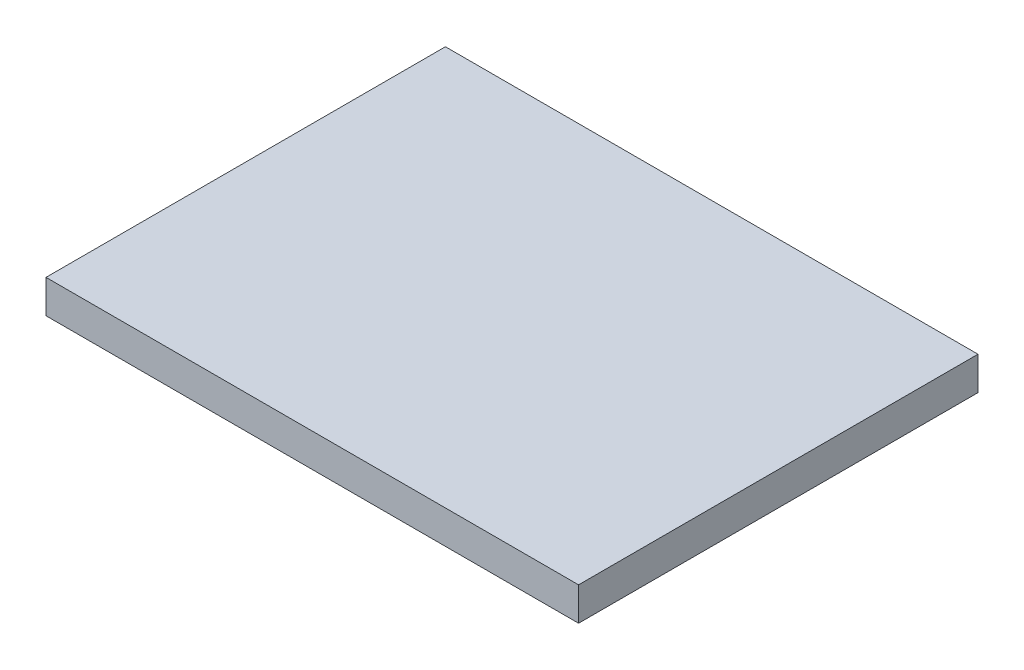
from build123d import *

# Parameters (mm, degrees)
SKETCH1_W           = 80
SKETCH1_H           = 60
BOSS_EXTRUDE1_DEPTH = 5


with BuildPart() as part:
    # Sketch1 → Boss-Extrude1 (new body)
    with BuildSketch(Plane(origin=(0, 0, 0), x_dir=(1, 0, 0), z_dir=(0, 1, 0))):
        with Locations((40, -30)):
            Rectangle(SKETCH1_W, SKETCH1_H)
    extrude(amount=BOSS_EXTRUDE1_DEPTH)


solid = part.part
